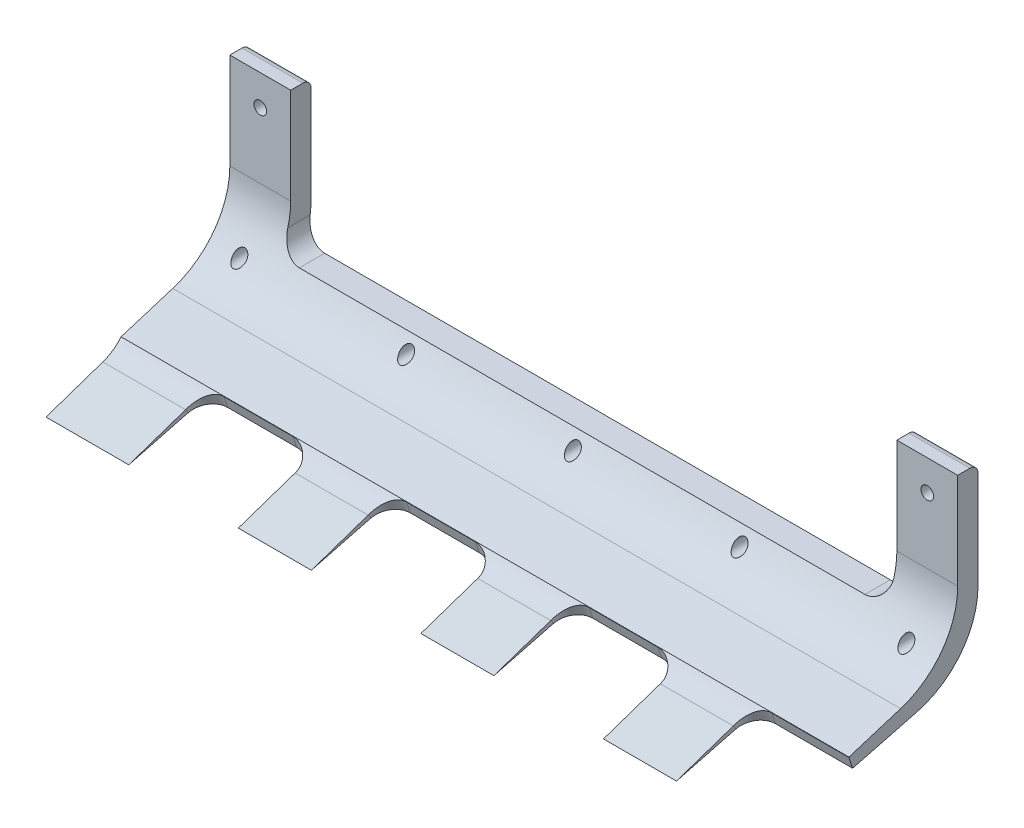
from build123d import *

# Parameters (mm, degrees)
BOSS_EXTRUDE1_DEPTH = 179.4
FILLET1_R           = 20
SKETCH2_W           = 149.4
SKETCH2_H           = 34
CUT_EXTRUDE1_DEPTH  = 89.7
FILLET2_R           = 5
FILLET3_R           = 2
CUT_EXTRUDE2_REACH  = 193.971
SKETCH3_R           = 1.55
SKETCH4_R           = 1.55
CUT_EXTRUDE3_DEPTH  = 89.7
CUT_EXTRUDE4_REACH  = 190.906
SKETCH6_W           = 27
SKETCH6_H           = 20
FILLET4_R           = 10
FILLET5_R           = 5


with BuildPart() as part:
    # Sketch1 → Boss-Extrude1 (new body)
    with BuildSketch(Plane(origin=(0, 0, 0), x_dir=(0, 0, -1), z_dir=(1, 0, 0))):
        Polygon((-2.5, 51.138937515), (-2.5, 12.731613167), (-29.312427031, 4.406457627), (-28.873869473, 2.972000493), (-47.815237798, -3.479647722), (2.5, 9.546261863), (2.5, 51.138937515), align=None)
    extrude(amount=BOSS_EXTRUDE1_DEPTH)

    # Fillet1
    fillet1_edges = [part.edges().sort_by_distance(p)[0] for p in [
        (89.7, 12.731613167, 2.5),
        (89.7, 9.546261863, -2.5),
    ]]
    fillet(fillet1_edges, radius=FILLET1_R)

    # Sketch2 → Cut-Extrude1 (cut, symmetric)
    with BuildSketch(Plane.XY.offset(2.5)):
        with Locations((89.7, 34.138937515)):
            Rectangle(SKETCH2_W, SKETCH2_H)
    extrude(amount=CUT_EXTRUDE1_DEPTH, both=True, mode=Mode.SUBTRACT)

    # Fillet2
    fillet2_edges = [part.edges().sort_by_distance(p)[0] for p in [
        (15, 17.138937515, 2.246332137),
        (164.4, 17.138937515, 2.246332137),
    ]]
    fillet(fillet2_edges, radius=FILLET2_R)

    # Fillet3
    fillet3_edges = [part.edges().sort_by_distance(p)[0] for p in [
        (171.9, 51.138937515, -2.5),
        (7.5, 51.138937515, -2.5),
    ]]
    fillet(fillet3_edges, radius=FILLET3_R)

    # Sketch3 → Cut-Extrude2 (cut, up to next)
    with BuildSketch(Plane.XY.offset(2.5), mode=Mode.PRIVATE) as cut_extrude2_sk1:
        with Locations((7.5, 43.638937515)):
            Circle(SKETCH3_R)
    cut_extrude2_tool1 = extrude(cut_extrude2_sk1.sketch, amount=-CUT_EXTRUDE2_REACH, mode=Mode.PRIVATE) & part.part
    # Sketch3 → Cut-Extrude2 (cut, up to next)
    with BuildSketch(Plane.XY.offset(2.5), mode=Mode.PRIVATE) as cut_extrude2_sk2:
        with Locations(Location((171.9, 43.638937515, 0), (0, 0, 90))):
            Circle(SKETCH3_R)
    cut_extrude2_tool2 = extrude(cut_extrude2_sk2.sketch, amount=-CUT_EXTRUDE2_REACH, mode=Mode.PRIVATE) & part.part
    add(cut_extrude2_tool1.solids().sort_by_distance((7.5, 43.638938, 2.5))[0], mode=Mode.SUBTRACT)
    add(cut_extrude2_tool2.solids().sort_by_distance((171.9, 43.638938, 2.5))[0], mode=Mode.SUBTRACT)

    # Sketch4 → Cut-Extrude3 (cut, symmetric)
    with BuildSketch(Plane.XY.offset(2.5)):
        with Locations((7.5, 14.138937515)):
            Circle(SKETCH4_R)
        with Locations((48.6, 14.138937515)):
            Circle(SKETCH4_R)
        with Locations((89.7, 14.138937515)):
            Circle(SKETCH4_R)
        with Locations((130.8, 14.138937515)):
            Circle(SKETCH4_R)
        with Locations((171.9, 14.138937515)):
            Circle(SKETCH4_R)
    extrude(amount=CUT_EXTRUDE3_DEPTH, both=True, mode=Mode.SUBTRACT)

    # Sketch6 → Cut-Extrude4 (cut, up to next)
    with BuildSketch(Plane(origin=(0, 11.475436404, 3.908665811), x_dir=(1, 0, 0), z_dir=(0, 0.9465961840789003, 0.32242156299984764)), mode=Mode.PRIVATE) as cut_extrude4_sk1:
        with Locations((168.9, -36.383635098)):
            Rectangle(SKETCH6_W, SKETCH6_H)
    cut_extrude4_tool1 = extrude(cut_extrude4_sk1.sketch, amount=-CUT_EXTRUDE4_REACH, mode=Mode.PRIVATE) & part.part
    # Sketch6 → Cut-Extrude4 (cut, up to next)
    with BuildSketch(Plane(origin=(0, 11.475436404, 3.908665811), x_dir=(1, 0, 0), z_dir=(0, 0.9465961840789003, 0.32242156299984764)), mode=Mode.PRIVATE) as cut_extrude4_sk2:
        with Locations((123.9, -36.383635098)):
            Rectangle(SKETCH6_W, SKETCH6_H)
    cut_extrude4_tool2 = extrude(cut_extrude4_sk2.sketch, amount=-CUT_EXTRUDE4_REACH, mode=Mode.PRIVATE) & part.part
    # Sketch6 → Cut-Extrude4 (cut, up to next)
    with BuildSketch(Plane(origin=(0, 11.475436404, 3.908665811), x_dir=(1, 0, 0), z_dir=(0, 0.9465961840789003, 0.32242156299984764)), mode=Mode.PRIVATE) as cut_extrude4_sk3:
        with Locations((78.9, -36.383635098)):
            Rectangle(SKETCH6_W, SKETCH6_H)
    cut_extrude4_tool3 = extrude(cut_extrude4_sk3.sketch, amount=-CUT_EXTRUDE4_REACH, mode=Mode.PRIVATE) & part.part
    # Sketch6 → Cut-Extrude4 (cut, up to next)
    with BuildSketch(Plane(origin=(0, 11.475436404, 3.908665811), x_dir=(1, 0, 0), z_dir=(0, 0.9465961840789003, 0.32242156299984764)), mode=Mode.PRIVATE) as cut_extrude4_sk4:
        with Locations((33.9, -36.383635098)):
            Rectangle(SKETCH6_W, SKETCH6_H)
    cut_extrude4_tool4 = extrude(cut_extrude4_sk4.sketch, amount=-CUT_EXTRUDE4_REACH, mode=Mode.PRIVATE) & part.part
    add(cut_extrude4_tool1.solids().sort_by_distance((168.9, -0.255432, 38.349276))[0], mode=Mode.SUBTRACT)
    add(cut_extrude4_tool2.solids().sort_by_distance((123.9, -0.255432, 38.349276))[0], mode=Mode.SUBTRACT)
    add(cut_extrude4_tool3.solids().sort_by_distance((78.9, -0.255432, 38.349276))[0], mode=Mode.SUBTRACT)
    add(cut_extrude4_tool4.solids().sort_by_distance((33.9, -0.255432, 38.349276))[0], mode=Mode.SUBTRACT)

    # Fillet4
    # the kernel refuses this fillet: 10 mm, written as the material it adds along each edge
    with BuildSketch(Plane(origin=(0, 2.972000493, 28.873869473), x_dir=(0, 0.9563047559630354, 0.29237170472273705), z_dir=(1, 0, 0))) as fillet4_piece_1_section:
        with BuildLine():
            CenterArc((9.83021397, 5.532407723), FILLET4_R, 181.809434134, 31.780194703)
            Line((-0.164799778, 5.216654382), (0, 0))
            Line((0, 0), (1.5, 0))
        make_face()
    fillet4_piece_1 = extrude(amount=179.4, mode=Mode.PRIVATE)
    fillet4_piece_1 = split(fillet4_piece_1, bisect_by=Plane(origin=(10.2, 4.355109275, 29.35551263), z_dir=(0, 0.32242156299984764, -0.9465961840789003)), keep=Keep.TOP, mode=Mode.PRIVATE)
    add(fillet4_piece_1)
    with BuildSketch(Plane(origin=(0, 2.972000493, 28.873869473), x_dir=(0, 0.9563047559630354, 0.29237170472273705), z_dir=(1, 0, 0))) as fillet4_piece_2_section:
        with BuildLine():
            CenterArc((9.83021397, 5.532407723), FILLET4_R, 181.809434134, 31.780194703)
            Line((-0.164799778, 5.216654382), (0, 0))
            Line((0, 0), (1.5, 0))
        make_face()
    fillet4_piece_2 = extrude(amount=192.448142088, mode=Mode.PRIVATE)
    fillet4_piece_2 = split(fillet4_piece_2, bisect_by=Plane(origin=(20.4, 2.498079927, 31.362258736), z_dir=(-1, 0, 0)), keep=Keep.TOP, mode=Mode.PRIVATE)
    add(fillet4_piece_2)
    with BuildSketch(Plane(origin=(-13.048142088, 2.972000493, 28.873869473), x_dir=(0, 0.9563047559630354, 0.29237170472273694), z_dir=(1, 0, 0))) as fillet4_piece_3_section:
        with BuildLine():
            CenterArc((9.83021397, 5.532407723), FILLET4_R, 181.809434134, 31.780194703)
            Line((-0.164799778, 5.216654382), (0, 0))
            Line((0, 0), (1.5, 0))
        make_face()
    fillet4_piece_3 = extrude(amount=205.496284175, mode=Mode.PRIVATE)
    fillet4_piece_3 = split(fillet4_piece_3, bisect_by=Plane(origin=(65.4, 2.498079927, 31.362258736), z_dir=(-1, 0, 0)), keep=Keep.TOP, mode=Mode.PRIVATE)
    fillet4_piece_3 = split(fillet4_piece_3, bisect_by=Plane(origin=(47.4, 2.498079927, 31.362258736), z_dir=(1, 0, 0)), keep=Keep.TOP, mode=Mode.PRIVATE)
    add(fillet4_piece_3)
    with BuildSketch(Plane(origin=(-13.048142088, 2.972000493, 28.873869473), x_dir=(0, 0.9563047559630354, 0.29237170472273694), z_dir=(1, 0, 0))) as fillet4_piece_4_section:
        with BuildLine():
            CenterArc((9.83021397, 5.532407723), FILLET4_R, 181.809434134, 31.780194703)
            Line((-0.164799778, 5.216654382), (0, 0))
            Line((0, 0), (1.5, 0))
        make_face()
    fillet4_piece_4 = extrude(amount=205.496284175, mode=Mode.PRIVATE)
    fillet4_piece_4 = split(fillet4_piece_4, bisect_by=Plane(origin=(110.4, 2.498079927, 31.362258736), z_dir=(-1, 0, 0)), keep=Keep.TOP, mode=Mode.PRIVATE)
    fillet4_piece_4 = split(fillet4_piece_4, bisect_by=Plane(origin=(92.4, 2.498079927, 31.362258736), z_dir=(1, 0, 0)), keep=Keep.TOP, mode=Mode.PRIVATE)
    add(fillet4_piece_4)
    with BuildSketch(Plane(origin=(-13.048142088, 2.972000493, 28.873869473), x_dir=(0, 0.9563047559630354, 0.29237170472273694), z_dir=(1, 0, 0))) as fillet4_piece_5_section:
        with BuildLine():
            CenterArc((9.83021397, 5.532407723), FILLET4_R, 181.809434134, 31.780194703)
            Line((-0.164799778, 5.216654382), (0, 0))
            Line((0, 0), (1.5, 0))
        make_face()
    fillet4_piece_5 = extrude(amount=205.496284175, mode=Mode.PRIVATE)
    fillet4_piece_5 = split(fillet4_piece_5, bisect_by=Plane(origin=(155.4, 2.498079927, 31.362258736), z_dir=(-1, 0, 0)), keep=Keep.TOP, mode=Mode.PRIVATE)
    fillet4_piece_5 = split(fillet4_piece_5, bisect_by=Plane(origin=(137.4, 2.498079927, 31.362258736), z_dir=(1, 0, 0)), keep=Keep.TOP, mode=Mode.PRIVATE)
    add(fillet4_piece_5)

    # Fillet5
    fillet5_edges = [part.edges().sort_by_distance(p)[0] for p in [
        (155.4, 2.950766774, 28.877177399),
        (110.4, 2.950766774, 28.877177399),
        (137.4, 2.950766774, 28.877177399),
        (65.4, 2.950766774, 28.877177399),
        (92.4, 2.950766774, 28.877177399),
        (20.4, 2.950766774, 28.877177399),
        (47.4, 2.950766774, 28.877177399),
    ]]
    fillet(fillet5_edges, radius=FILLET5_R)


solid = part.part
